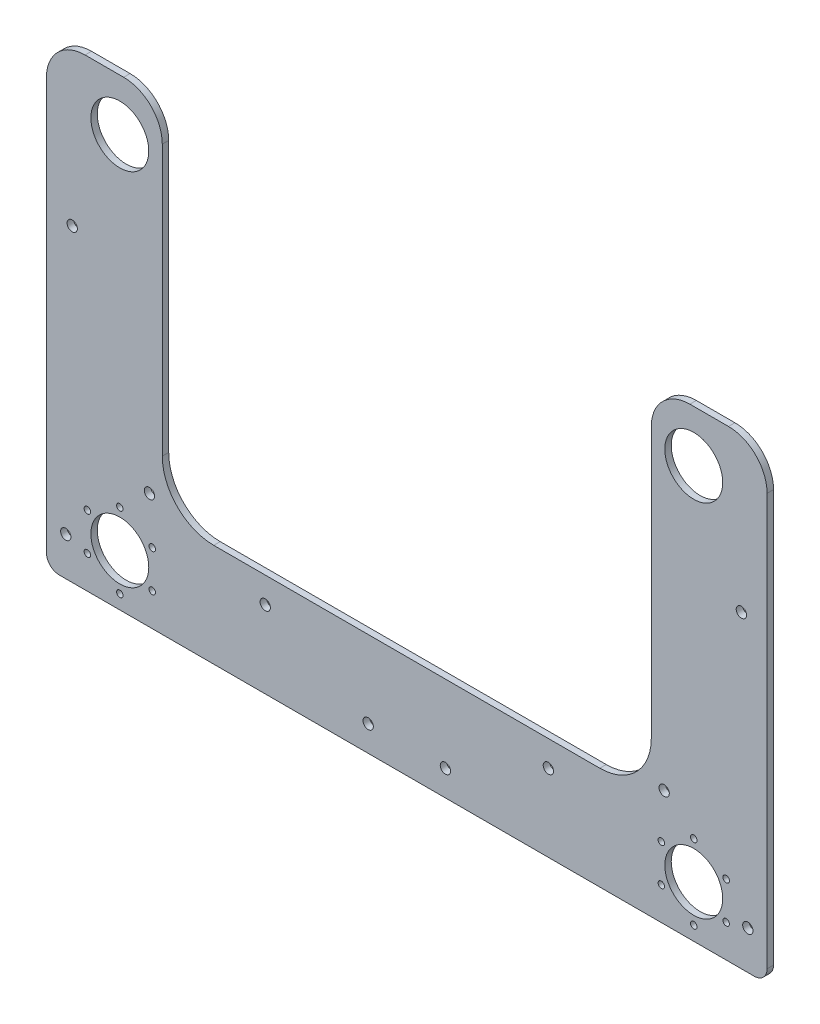
from build123d import *

# Parameters (mm, degrees)
SKETCH1_R           = 14.2875
SKETCH1_R_2         = 1.6002
SKETCH1_R_3         = 2.54
BOSS_EXTRUDE3_DEPTH = 3.175
SKETCH2_W           = 355.6
SKETCH2_H           = 19.05
CUT_EXTRUDE1_DEPTH  = 290.621961572
FILLET1_R           = 19.05


with BuildPart() as part:
    # Sketch1 → Boss-Extrude3 (new body)
    with BuildSketch(Plane.XY):
        with BuildLine():
            Line((120.65, -152.4), (120.65, -6.35))
            Line((120.65, -6.35), (120.65, 6.35))
            ThreePointArc((120.65, 6.35), (124.369743879, 15.330256121), (133.35, 19.05))
            Line((133.35, 19.05), (165.1, 19.05))
            ThreePointArc((165.1, 19.05), (174.080256121, 15.330256121), (177.8, 6.35))
            Line((177.8, 6.35), (177.8, -6.35))
            Line((177.8, -6.35), (177.8, -222.25))
            ThreePointArc((177.8, -222.25), (175.940128061, -226.740128061), (171.45, -228.6))
            Line((171.45, -228.6), (12.7, -228.6))
            Line((12.7, -228.6), (-12.7, -228.6))
            Line((-12.7, -228.6), (-171.45, -228.6))
            ThreePointArc((-171.45, -228.6), (-175.940128061, -226.740128061), (-177.8, -222.25))
            Line((-177.8, -222.25), (-177.8, -6.35))
            Line((-177.8, -6.35), (-177.8, 6.35))
            ThreePointArc((-177.8, 6.35), (-174.080256121, 15.330256121), (-165.1, 19.05))
            Line((-165.1, 19.05), (-133.35, 19.05))
            ThreePointArc((-133.35, 19.05), (-124.369743879, 15.330256121), (-120.65, 6.35))
            Line((-120.65, 6.35), (-120.65, -6.35))
            Line((-120.65, -6.35), (-120.65, -152.4))
            ThreePointArc((-120.65, -152.4), (-113.210512242, -170.360512242), (-95.25, -177.8))
            Line((-95.25, -177.8), (-12.7, -177.8))
            Line((-12.7, -177.8), (12.7, -177.8))
            Line((12.7, -177.8), (95.25, -177.8))
            ThreePointArc((95.25, -177.8), (113.210512242, -170.360512242), (120.65, -152.4))
        make_face()
        with Locations((141.605, -25.4)):
            Circle(SKETCH1_R, mode=Mode.SUBTRACT)
        with Locations((-141.605, -25.4)):
            Circle(SKETCH1_R, mode=Mode.SUBTRACT)
        with Locations((-141.605, -203.2)):
            Circle(SKETCH1_R, mode=Mode.SUBTRACT)
        with Locations((-141.605, -184.722481985)):
            Circle(SKETCH1_R_2, mode=Mode.SUBTRACT)
        with Locations((-125.603, -193.961240992)):
            Circle(SKETCH1_R_2, mode=Mode.SUBTRACT)
        with Locations((-125.603, -212.438759008)):
            Circle(SKETCH1_R_2, mode=Mode.SUBTRACT)
        with Locations((-141.605, -221.677518015)):
            Circle(SKETCH1_R_2, mode=Mode.SUBTRACT)
        with Locations((-157.607, -212.438759008)):
            Circle(SKETCH1_R_2, mode=Mode.SUBTRACT)
        with Locations((-157.607, -193.961240992)):
            Circle(SKETCH1_R_2, mode=Mode.SUBTRACT)
        with Locations((157.607, -212.438759008)):
            Circle(SKETCH1_R_2, mode=Mode.SUBTRACT)
        with Locations((157.607, -193.961240992)):
            Circle(SKETCH1_R_2, mode=Mode.SUBTRACT)
        with Locations((141.605, -184.722481985)):
            Circle(SKETCH1_R_2, mode=Mode.SUBTRACT)
        with Locations((125.603, -193.961240992)):
            Circle(SKETCH1_R_2, mode=Mode.SUBTRACT)
        with Locations((125.603, -212.438759008)):
            Circle(SKETCH1_R_2, mode=Mode.SUBTRACT)
        with Locations((141.605, -221.677518015)):
            Circle(SKETCH1_R_2, mode=Mode.SUBTRACT)
        with Locations((141.605, -203.2)):
            Circle(SKETCH1_R, mode=Mode.SUBTRACT)
        with Locations((-69.85, -190.5)):
            Circle(SKETCH1_R_3, mode=Mode.SUBTRACT)
        with Locations((69.85, -190.5)):
            Circle(SKETCH1_R_3, mode=Mode.SUBTRACT)
        with Locations((-19.05, -215.9)):
            Circle(SKETCH1_R_3, mode=Mode.SUBTRACT)
        with Locations((-127, -171.45)):
            Circle(SKETCH1_R_3, mode=Mode.SUBTRACT)
        with Locations((-149.225, 6.35)):
            Circle(SKETCH1_R_3, mode=Mode.SUBTRACT)
        with Locations((127, -171.45)):
            Circle(SKETCH1_R_3, mode=Mode.SUBTRACT)
        with Locations((149.225, 6.35)):
            Circle(SKETCH1_R_3, mode=Mode.SUBTRACT)
        with Locations((-168.275, -209.55)):
            Circle(SKETCH1_R_3, mode=Mode.SUBTRACT)
        with Locations((168.275, -209.55)):
            Circle(SKETCH1_R_3, mode=Mode.SUBTRACT)
        with Locations((-165.1, -76.2)):
            Circle(SKETCH1_R_3, mode=Mode.SUBTRACT)
        with Locations((165.1, -76.2)):
            Circle(SKETCH1_R_3, mode=Mode.SUBTRACT)
        with Locations((19.05, -215.9)):
            Circle(SKETCH1_R_3, mode=Mode.SUBTRACT)
    extrude(amount=BOSS_EXTRUDE3_DEPTH)

    # Sketch2 → Cut-Extrude1 (cut, through all)
    with BuildSketch(Plane.XY.offset(3.175)):
        with Locations((0, 9.525)):
            Rectangle(SKETCH2_W, SKETCH2_H)
    extrude(amount=-CUT_EXTRUDE1_DEPTH, mode=Mode.SUBTRACT)

    # Fillet1
    fillet1_edges = [part.edges().sort_by_distance(p)[0] for p in [
        (177.8, 0, 1.5875),
        (120.65, 0, 1.5875),
        (-120.65, 0, 1.5875),
        (-177.8, 0, 1.5875),
    ]]
    fillet(fillet1_edges, radius=FILLET1_R)


solid = part.part
